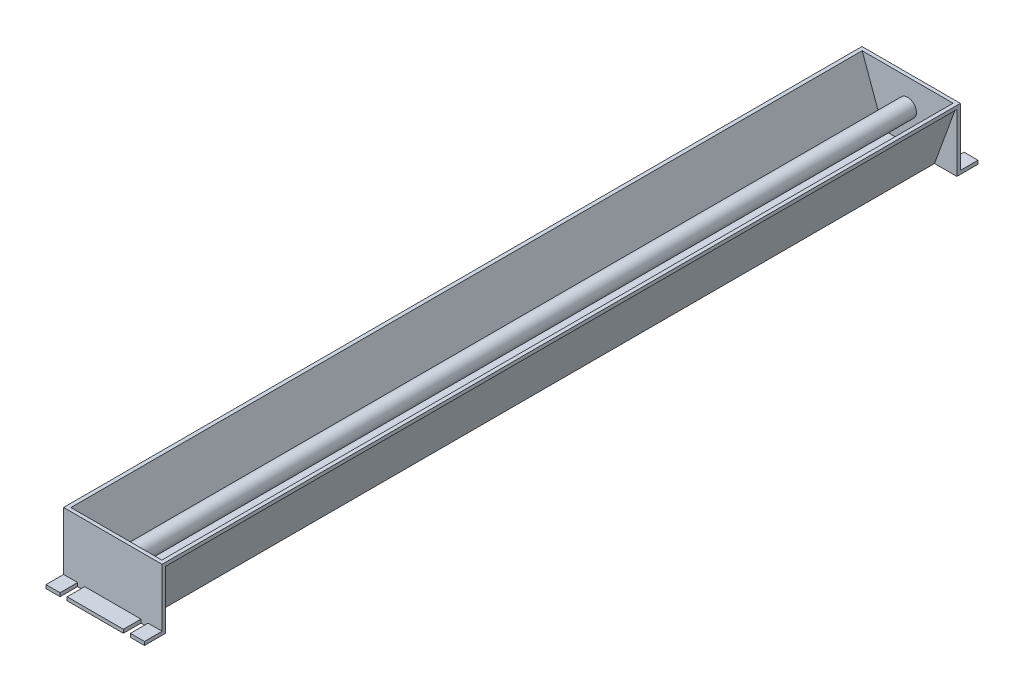
from build123d import *

# Parameters (mm, degrees)
SKETCH_1_W             = 56
SKETCH_1_H             = 35
EXTRUDE_1_DEPTH        = 2
EXTRUDE_2_DEPTH        = 225
EXTRUDE_START          = -12
EXTRUDE_5_DEPTH        = 10
SKETCH_16_R            = 5
EXTRUDE_6_DEPTH        = 225
SKETCH_15_W            = 4
SKETCH_15_H            = 10
CUT_EXTRUDE_1_DEPTH    = 10
MIRROR_START           = 225
MIRROR_1_OUTLINE_R     = 5
MIRROR_1_DEPTH         = 227
MIRROR_START_2         = 450
MIRROR_1_2_OUTLINE_R   = 5
MIRROR_1_2_DEPTH       = 2
MIRROR_START_3         = 452
MIRROR_1_3_OUTLINE_W   = 32
MIRROR_1_3_OUTLINE_H   = 2
MIRROR_1_3_OUTLINE_W_2 = 8
MIRROR_1_3_DEPTH       = 10


# Read off the part's stored shape, not the designer's step: 凸台-拉伸2, 镜向1
with BuildPart() as part:
    # 草图1 (on Front Plane) → 凸台-拉伸1 (new body)
    with BuildSketch(Plane.XY):
        with Locations((28, 17.5)):
            Rectangle(SKETCH_1_W, SKETCH_1_H)
    extrude(amount=-EXTRUDE_1_DEPTH)

    # 凸台-拉伸2 outline → 凸台-拉伸2 (add)
    with BuildSketch(Plane.XY):
        Polygon((0, 35), (0, 33), (0.727940469, 33), (12.738958199, 0), (43.261041801, 0), (55.272059531, 33), (56, 33), (56, 35), (53.871644455, 35), (41.860626724, 2), (14.139373276, 2), (2.128355545, 35), align=None)
    extrude(amount=EXTRUDE_2_DEPTH)

    # 草图1<10> (on Front Plane) → 凸台-拉伸5 (add)
    with BuildSketch(Plane.XY.offset(EXTRUDE_START)):
        Polygon((28, 2), (14.139373276, 2), (14.867313744, 0), (28, 0), align=None)
        Polygon((14.139373276, 2), (12.011017731, 2), (12.738958199, 0), (14.867313744, 0), align=None)
        Polygon((12.738958199, 0), (12.011017731, 2), (0, 2), (0, 0), align=None)
        Polygon((41.860626724, 2), (28, 2), (28, 0), (41.132686256, 0), align=None)
        Polygon((56, 2), (43.988982269, 2), (43.261041801, 0), (56, 0), align=None)
        Polygon((43.988982269, 2), (41.860626724, 2), (41.132686256, 0), (43.261041801, 0), align=None)
    extrude(amount=EXTRUDE_5_DEPTH)

    # 草图16 → 凸台-拉伸6 (add)
    with BuildSketch(Plane.XY):
        with Locations((28, 20)):
            Circle(SKETCH_16_R)
    extrude(amount=EXTRUDE_6_DEPTH)

    # 草图15 → 切除-拉伸1 (cut)
    with BuildSketch(Plane(origin=(0, 2, 0), x_dir=(1, 0, 0), z_dir=(0, 1, 0))):
        with Locations((46, -457)):
            Rectangle(SKETCH_15_W, SKETCH_15_H)
        with Locations((10, 7)):
            Rectangle(SKETCH_15_W, SKETCH_15_H)
        with Locations((46, 7)):
            Rectangle(SKETCH_15_W, SKETCH_15_H)
        with Locations((10, -457)):
            Rectangle(SKETCH_15_W, SKETCH_15_H)
    extrude(amount=-CUT_EXTRUDE_1_DEPTH, mode=Mode.SUBTRACT)

    # 镜向1 outline → 镜向1 (add)
    with BuildSketch(Plane.XY.offset(MIRROR_START)):
        Polygon((43.261041801, 0), (55.272059531, 33), (56, 33), (56, 35), (53.871644455, 35), (41.860626724, 2), (14.139373276, 2), (2.128355545, 35), (0, 35), (0, 33), (0.727940469, 33), (12.738958199, 0), align=None)
        with Locations((28, 20)):
            Circle(MIRROR_1_OUTLINE_R)
    extrude(amount=MIRROR_1_DEPTH)

    # Mirror 1 2 outline → Mirror 1 2 (add)
    # profile 1 of 3: a face of its own
    with BuildSketch(Plane.XY.offset(MIRROR_START_2)):
        Polygon((14.139373276, 2), (41.860626724, 2), (53.871644455, 35), (2.128355545, 35), align=None)
        with Locations((28, 20)):
            Circle(MIRROR_1_2_OUTLINE_R, mode=Mode.SUBTRACT)
    # profile 2 of 3: a face of its own
    with BuildSketch(Plane.XY.offset(MIRROR_START_2)):
        Polygon((55.272059531, 33), (43.261041801, 0), (56, 0), (56, 33), align=None)
    # profile 3 of 3: a face of its own
    with BuildSketch(Plane.XY.offset(MIRROR_START_2)):
        Polygon((12.738958199, 0), (0.727940469, 33), (0, 33), (0, 0), align=None)
    extrude(amount=MIRROR_1_2_DEPTH)

    # Mirror 1 3 outline → Mirror 1 3 (add)
    with BuildSketch(Plane.XY.offset(MIRROR_START_3)):
        with Locations((28, 1)):
            Rectangle(MIRROR_1_3_OUTLINE_W, MIRROR_1_3_OUTLINE_H)
        with Locations((52, 1)):
            Rectangle(MIRROR_1_3_OUTLINE_W_2, MIRROR_1_3_OUTLINE_H)
        with Locations((4, 1)):
            Rectangle(MIRROR_1_3_OUTLINE_W_2, MIRROR_1_3_OUTLINE_H)
    extrude(amount=MIRROR_1_3_DEPTH)


solid = part.part
